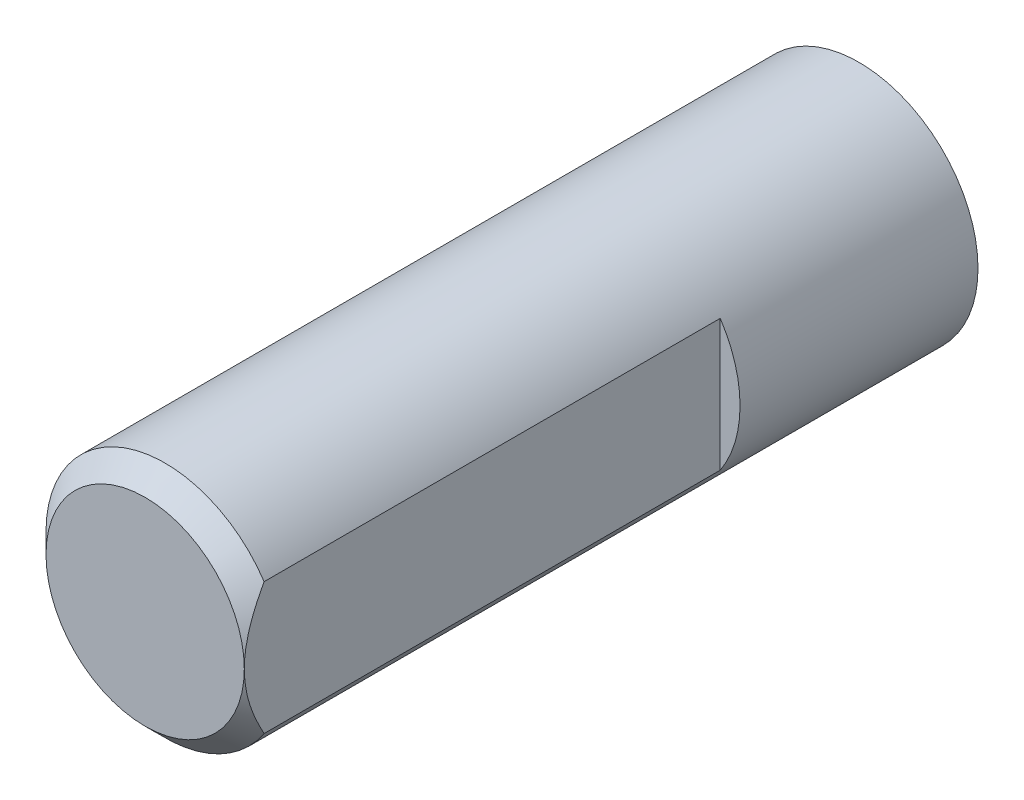
from build123d import *

# Parameters (mm, degrees)
SKETCH1_R           = 3
BOSS_EXTRUDE1_DEPTH = 18
CUT_EXTRUDE1_START  = -12
CUT_EXTRUDE1_DEPTH  = 12
CHAMFER1_SIZE       = 0.5


with BuildPart() as part:
    # Sketch1 → Boss-Extrude1 (new body)
    with BuildSketch(Plane.XY):
        Circle(SKETCH1_R)
    extrude(amount=BOSS_EXTRUDE1_DEPTH)

    # Sketch2 → Cut-Extrude1 (cut)
    with BuildSketch(Plane.XY.offset(18).offset(CUT_EXTRUDE1_START)):
        with BuildLine():
            Line((2.5, 1.658312395), (2.5, -1.658312395))
            ThreePointArc((2.5, -1.658312395), (3, 0), (2.5, 1.658312395))
        make_face()
    extrude(amount=CUT_EXTRUDE1_DEPTH, mode=Mode.SUBTRACT)

    # Chamfer1
    chamfer1_edges = [part.edges().sort_by_distance(p)[0] for p in [
        (-3, 0, 18),
    ]]
    chamfer(chamfer1_edges, length=CHAMFER1_SIZE - 0.0001)  # a hair under: the kernel refuses the full size


solid = part.part
